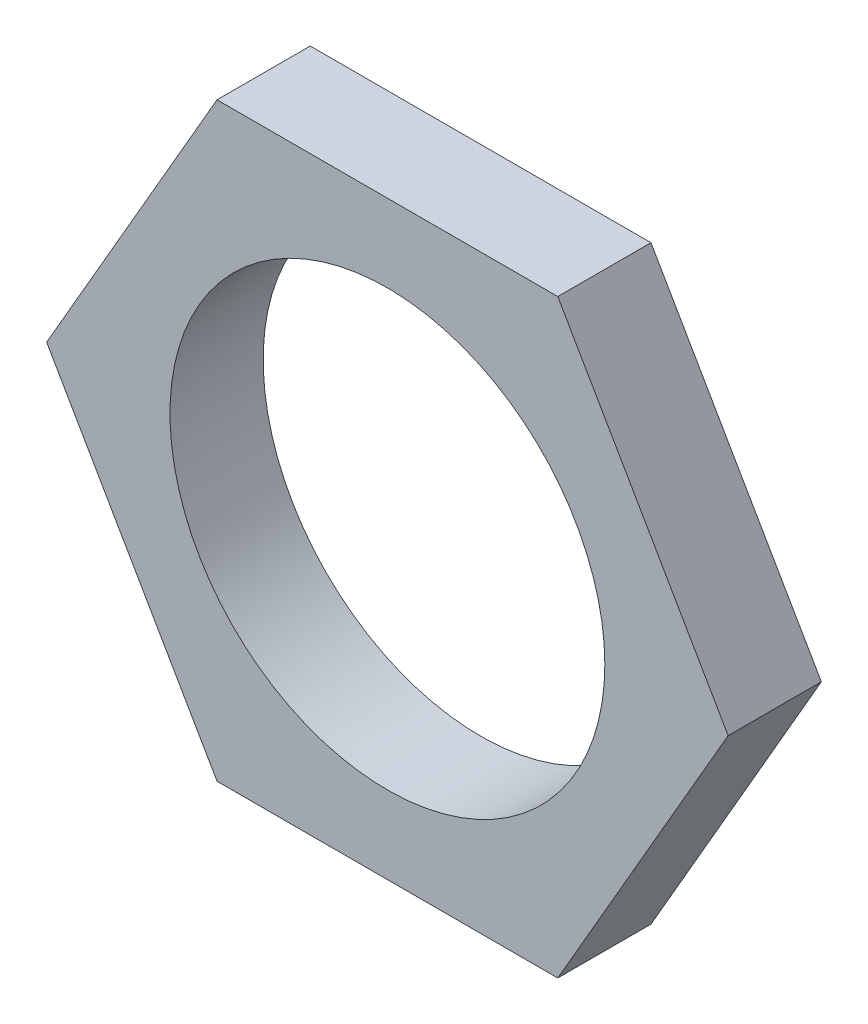
from build123d import *

# Parameters (mm, degrees)
BOSS_EXTRUDE1_DEPTH = 1.5
SKETCH2_R           = 3.5
CUT_EXTRUDE1_DEPTH  = 1.5


with BuildPart() as part:
    # Sketch1 → Boss-Extrude1 (new body)
    with BuildSketch(Plane.XY):
        Polygon((-5.484827557, 0), (-2.742413779, -4.75), (2.742413779, -4.75), (5.484827557, 0), (2.742413779, 4.75), (-2.742413779, 4.75), align=None)
    extrude(amount=BOSS_EXTRUDE1_DEPTH)

    # Sketch2 → Cut-Extrude1 (cut)
    with BuildSketch(Plane.XY.offset(1.5)):
        Circle(SKETCH2_R)
    extrude(amount=-CUT_EXTRUDE1_DEPTH, mode=Mode.SUBTRACT)


solid = part.part
